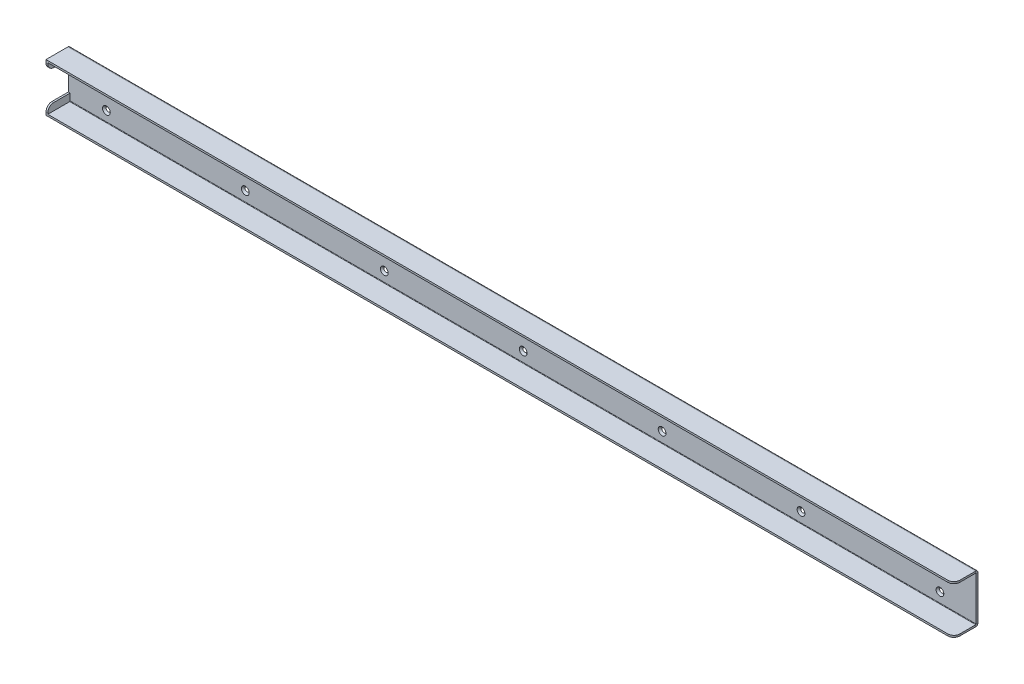
from build123d import *

# Parameters (mm, degrees)
SKETCH_1_W                         = 1500
SKETCH_1_H                         = 80
SM_BASE_FLANGE_1_DEPTH             = 3
SM_EDGE_FLANGE_1_STRIP_W           = 13.4732
SM_EDGE_FLANGE_1_STRIP_H           = 3
SM_EDGE_FLANGE_1_STRIP_CUT_DEPTH   = 1500
SM_EDGE_FLANGE_1_STRIP_2_W         = 13.4732
SM_EDGE_FLANGE_1_STRIP_2_H         = 3
SM_EDGE_FLANGE_1_STRIP_CUT_2_DEPTH = 1500
SM_EDGE_FLANGE_1_DEPTH             = 1500
SM_EDGE_FLANGE_1_BEND_DEPTH        = 1500
EXTRUDE_1_DEPTH                    = 3
SKETCH_13_W                        = 74
SKETCH_13_H                        = 50
CUT_EXTRUDE_3_DEPTH                = 3
FILLET_1_R                         = 10
HOLE_WIZARD_1_AT_2_COUNT           = 2
HOLE_WIZARD_1_AT_2_PITCH           = 40
PATTERN_LINEAR_1_COUNT             = 4
PATTERN_LINEAR_1_PITCH             = 230
PATTERN_LINEAR_1_COL_COUNT         = 4
PATTERN_LINEAR_1_COL_PITCH         = 230


# Sheet-metal steps are written as plain solids
with BuildPart() as part:
    # Sketch 1 → 基体-法兰1 (new body)
    with BuildSketch(Plane.XY):
        Rectangle(SKETCH_1_W, SKETCH_1_H)
    extrude(amount=-SM_BASE_FLANGE_1_DEPTH)

    # 边线-法兰1 strip (across the edge) → 边线-法兰1 strip cut (cut)
    with BuildSketch(Plane(origin=(-750, -40, 0), x_dir=(0, 1, 0), z_dir=(1, 0, 0))):
        with Locations((-3, -1.5)):
            Rectangle(SM_EDGE_FLANGE_1_STRIP_W, SM_EDGE_FLANGE_1_STRIP_H)
    extrude(amount=SM_EDGE_FLANGE_1_STRIP_CUT_DEPTH, mode=Mode.SUBTRACT)

    # 边线-法兰1 strip 2 (across the edge) → 边线-法兰1 strip cut 2 (cut)
    with BuildSketch(Plane(origin=(750, 40, 0), x_dir=(0, -1, 0), z_dir=(-1, 0, 0))):
        with Locations((-3, -1.5)):
            Rectangle(SM_EDGE_FLANGE_1_STRIP_2_W, SM_EDGE_FLANGE_1_STRIP_2_H)
    extrude(amount=SM_EDGE_FLANGE_1_STRIP_CUT_2_DEPTH, mode=Mode.SUBTRACT)

    # 边线-法兰1 section (across the edge) → 边线-法兰1 (add)
    with BuildSketch(Plane(origin=(-750, -40, 0), x_dir=(0, 1, 0), z_dir=(1, 0, 0))):
        with BuildLine():
            Line((0, 0.7366), (0, 37))
            Line((0, 37), (3, 37))
            Line((3, 37), (3, 0.7366))
            ThreePointArc((3, 0.7366), (3.215745145, 0.215745145), (3.7366, 0))
            Line((3.7366, 0), (3.7366, -3))
            ThreePointArc((3.7366, -3), (1.094424801, -1.905575199), (0, 0.7366))
        make_face()
    extrude(amount=SM_EDGE_FLANGE_1_DEPTH)

    # 边线-法兰1 section 2 (across the edge) → 边线-法兰1 bend (add)
    with BuildSketch(Plane(origin=(750, 40, 0), x_dir=(0, -1, 0), z_dir=(-1, 0, 0))):
        with BuildLine():
            Line((0, 0.7366), (0, 37))
            Line((0, 37), (3, 37))
            Line((3, 37), (3, 0.7366))
            ThreePointArc((3, 0.7366), (3.215745145, 0.215745145), (3.7366, 0))
            Line((3.7366, 0), (3.7366, -3))
            ThreePointArc((3.7366, -3), (1.094424801, -1.905575199), (0, 0.7366))
        make_face()
    extrude(amount=SM_EDGE_FLANGE_1_BEND_DEPTH)

    # 草图12 → 凸台-拉伸1 (add)
    with BuildSketch(Plane.ZY.offset(750)):
        with BuildLine():
            Line((37, -40), (0.7366, -40))
            ThreePointArc((0.7366, -40), (-1.905575199, -38.905575199), (-3, -36.2634))
            Line((-3, -36.2634), (-3, 36.2634))
            ThreePointArc((-3, 36.2634), (-1.905575199, 38.905575199), (0.7366, 40))
            Line((0.7366, 40), (37, 40))
            Line((37, 40), (37, -40))
        make_face()
    extrude(amount=EXTRUDE_1_DEPTH)

    # 草图13 → 切除-拉伸3 (cut)
    with BuildSketch(Plane.ZY.offset(753)):
        with Locations((37, 0)):
            Rectangle(SKETCH_13_W, SKETCH_13_H)
    extrude(amount=-CUT_EXTRUDE_3_DEPTH, mode=Mode.SUBTRACT)

    # 圆角1
    fillet_1_edges = [part.edges().sort_by_distance(p)[0] for p in [
        (-751.5, 25, 37),
        (-751.5, -25, 37),
        (750, -38.5, 37),
        (750, 38.5, 37),
    ]]
    fillet(fillet_1_edges, radius=FILLET_1_R)

    # 草图15 → 打孔尺寸(%根据)内六角花形沉头螺钉的类型1 (revolve, cut)
    with BuildSketch(Plane(origin=(0, 20, 0), x_dir=(0, -1, 0), z_dir=(1, 0, 0))):
        Polygon((0, 0), (0, 26.482840043), (3.3, 24.5), (3.3, 3.1), (6.4, 0), align=None)
    hole_wizard_1 = revolve(axis=Axis((0, 20, 6.35), (0, 0, -1)), mode=Mode.SUBTRACT)

    # 打孔尺寸(%根据)内六角花形沉头螺钉的类型1 at 2: 打孔尺寸(%根据)内六角花形沉头螺钉的类型1 ×2
    with Locations(*[(0, -i * HOLE_WIZARD_1_AT_2_PITCH, 0) for i in range(1, HOLE_WIZARD_1_AT_2_COUNT)]):
        add(hole_wizard_1, mode=Mode.SUBTRACT)

    # 阵列(线性)1: 打孔尺寸(%根据)内六角花形沉头螺钉的类型1 ×4
    with Locations(*[(-i * PATTERN_LINEAR_1_PITCH, 0, 0) for i in range(1, PATTERN_LINEAR_1_COUNT)]):
        add(hole_wizard_1, mode=Mode.SUBTRACT)

    # 阵列(线性)1 copy 1 sketch → 阵列(线性)1 copy 1 (revolve, cut)
    with BuildSketch(Plane(origin=(-230, -20, 0), x_dir=(0, -1, 0), z_dir=(1, 0, 0))):
        Polygon((0, 0), (0, 26.482840043), (3.3, 24.5), (3.3, 3.1), (6.4, 0), align=None)
    revolve(axis=Axis((-230, -20, 6.35), (0, 0, -1)), mode=Mode.SUBTRACT)

    # 阵列(线性)1 copy 2 sketch → 阵列(线性)1 copy 2 (revolve, cut)
    with BuildSketch(Plane(origin=(-460, -20, 0), x_dir=(0, -1, 0), z_dir=(1, 0, 0))):
        Polygon((0, 0), (0, 26.482840043), (3.3, 24.5), (3.3, 3.1), (6.4, 0), align=None)
    revolve(axis=Axis((-460, -20, 6.35), (0, 0, -1)), mode=Mode.SUBTRACT)

    # 阵列(线性)1 copy 3 sketch → 阵列(线性)1 copy 3 (revolve, cut)
    with BuildSketch(Plane(origin=(-690, -20, 0), x_dir=(0, -1, 0), z_dir=(1, 0, 0))):
        Polygon((0, 0), (0, 26.482840043), (3.3, 24.5), (3.3, 3.1), (6.4, 0), align=None)
    revolve(axis=Axis((-690, -20, 6.35), (0, 0, -1)), mode=Mode.SUBTRACT)

    # 阵列(线性)1 col: 打孔尺寸(%根据)内六角花形沉头螺钉的类型1 ×4
    with Locations(*[(i * PATTERN_LINEAR_1_COL_PITCH, 0, 0) for i in range(1, PATTERN_LINEAR_1_COL_COUNT)]):
        add(hole_wizard_1, mode=Mode.SUBTRACT)

    # 阵列(线性)1 col copy 1 sketch → 阵列(线性)1 col copy 1 (revolve, cut)
    with BuildSketch(Plane(origin=(230, -20, 0), x_dir=(0, -1, 0), z_dir=(1, 0, 0))):
        Polygon((0, 0), (0, 26.482840043), (3.3, 24.5), (3.3, 3.1), (6.4, 0), align=None)
    revolve(axis=Axis((230, -20, 6.35), (0, 0, -1)), mode=Mode.SUBTRACT)

    # 阵列(线性)1 col copy 2 sketch → 阵列(线性)1 col copy 2 (revolve, cut)
    with BuildSketch(Plane(origin=(460, -20, 0), x_dir=(0, -1, 0), z_dir=(1, 0, 0))):
        Polygon((0, 0), (0, 26.482840043), (3.3, 24.5), (3.3, 3.1), (6.4, 0), align=None)
    revolve(axis=Axis((460, -20, 6.35), (0, 0, -1)), mode=Mode.SUBTRACT)

    # 阵列(线性)1 col copy 3 sketch → 阵列(线性)1 col copy 3 (revolve, cut)
    with BuildSketch(Plane(origin=(690, -20, 0), x_dir=(0, -1, 0), z_dir=(1, 0, 0))):
        Polygon((0, 0), (0, 26.482840043), (3.3, 24.5), (3.3, 3.1), (6.4, 0), align=None)
    revolve(axis=Axis((690, -20, 6.35), (0, 0, -1)), mode=Mode.SUBTRACT)


solid = part.part
